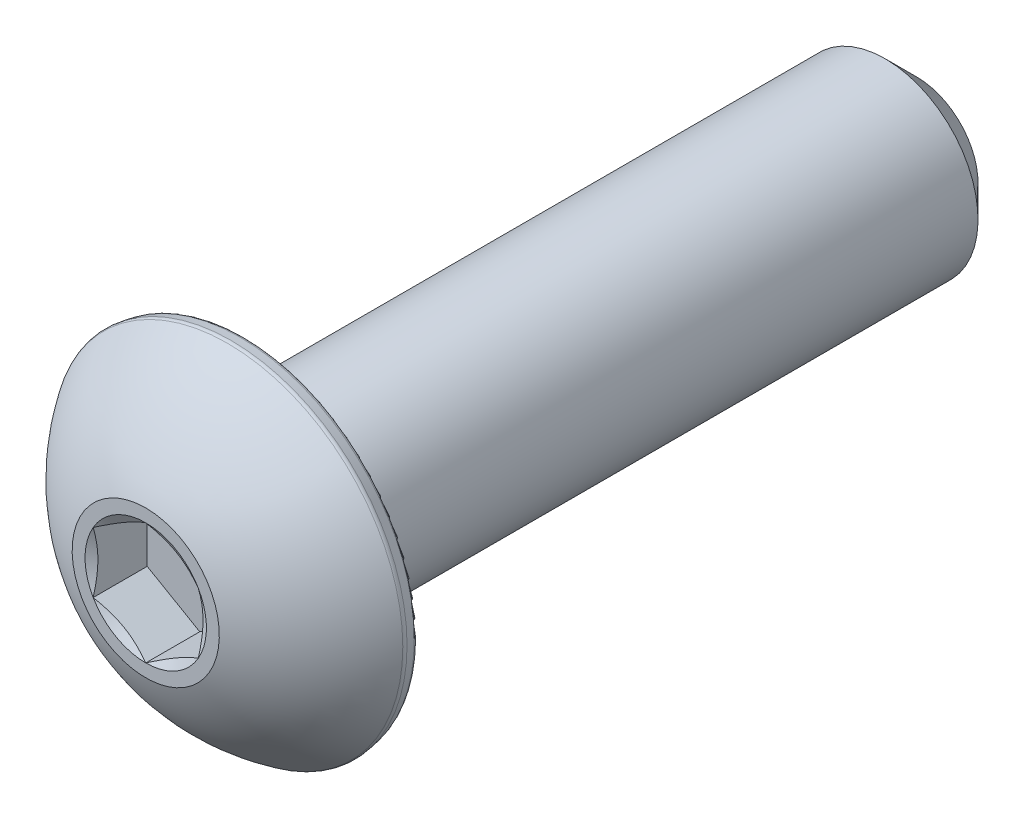
from build123d import *

# Parameters (mm, degrees)
CUT_EXTRUDE1_DEPTH = 1.01981
FILLET1_R          = 0.09271


with BuildPart() as part:
    # Sketch2 → Revolve1 (revolve)
    with BuildSketch(Plane(origin=(0, 0, 0), x_dir=(0, 0, -1), z_dir=(1, 0, 0))):
        with BuildLine():
            Line((12.7, 0), (-1.8542, 0))
            Line((-1.8542, 0), (-1.8542, 1.3890625))
            ThreePointArc((-1.8542, 1.3890625), (-1.223810995, 2.486413841), (-0.27813, 3.3274))
            Line((-0.27813, 3.3274), (0, 3.278358177))
            Line((0, 3.278358177), (0, 1.7526))
            Line((0, 1.7526), (12.1046875, 1.7526))
            Line((12.1046875, 1.7526), (12.7, 1.1572875))
            Line((12.7, 1.1572875), (12.7, 0))
        make_face()
    revolve(axis=Axis((0, 0, -12.7), (0, 0, 1)))

    # Sketch3 → Cut-Extrude1 (cut)
    with BuildSketch(Plane.XY.offset(1.8542)):
        Polygon((0, 1.14567944), (-0.9921875, 0.57283972), (-0.9921875, -0.57283972), (0, -1.14567944), (0.9921875, -0.57283972), (0.9921875, 0.57283972), align=None)
    extrude(amount=-CUT_EXTRUDE1_DEPTH, mode=Mode.SUBTRACT)

    # Cut-Extrude2 cone 1 section (through the dimple's axis) → Cut-Extrude2 (revolve, cut)
    with BuildSketch(Plane(origin=(0, 0, 1.8542), x_dir=(0, -1, 0), z_dir=(1, 0, 0))):
        Polygon((0, 0), (1.14567944, 0), (0, 0.661458333), align=None)
    revolve(axis=Axis((0, 0, 1.8542), (0, 0, -1)), mode=Mode.SUBTRACT)

    # Fillet1
    fillet1_edges = [part.edges().sort_by_distance(p)[0] for p in [
        (0, -3.3274, 0.27813),
        (0, -3.278358177, 0),
    ]]
    fillet(fillet1_edges, radius=FILLET1_R)


solid = part.part
